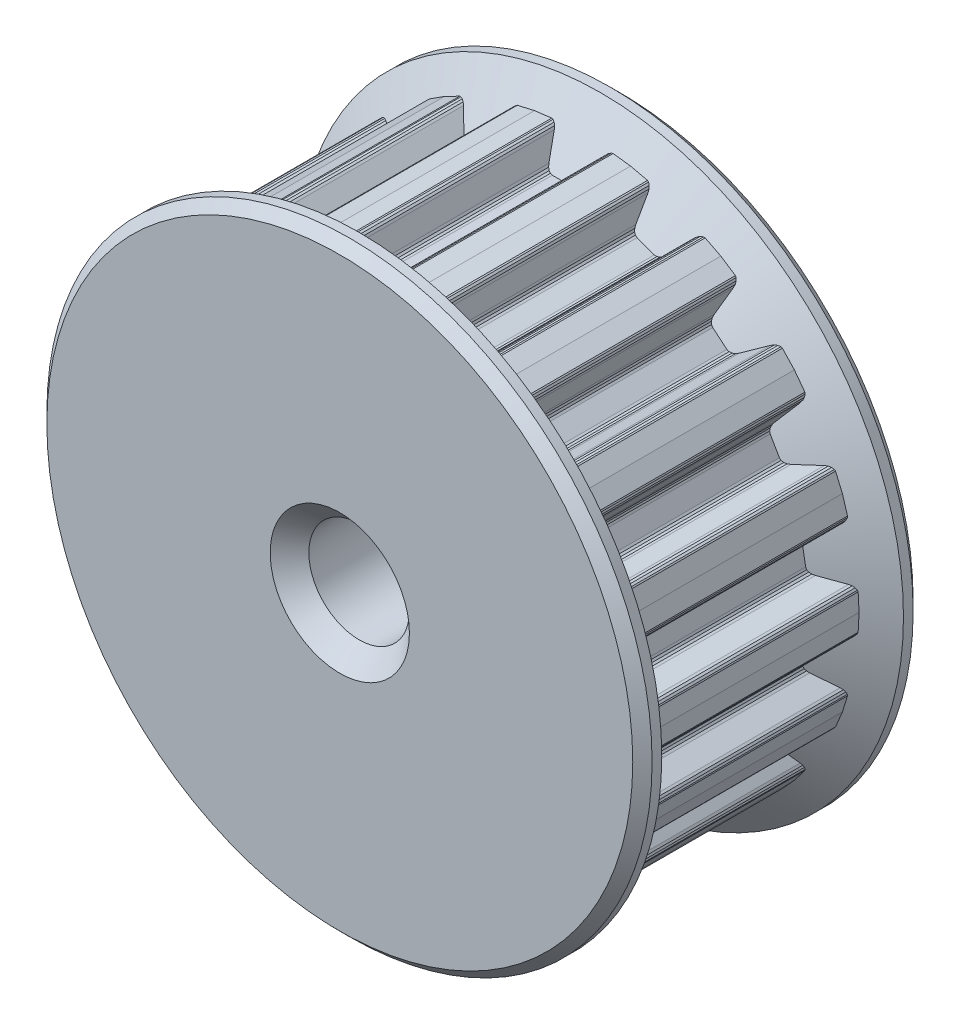
from build123d import *

# Parameters (mm, degrees)
SKETCH1_R           = 12.65
SKETCH1_R_2         = 2.6
BOSS_EXTRUDE1_DEPTH = 6.25
SKETCH2_R           = 15.65
SKETCH2_R_2         = 2.6
BOSS_EXTRUDE2_DEPTH = 1
CHAMFER1_SIZE       = 2.100622615
CHAMFER1_SIZE_2     = 3
CHAMFER2_SIZE       = 0.5
CHAMFER3_SIZE       = 1
SKETCH3_R           = 12.65
BOSS_EXTRUDE3_DEPTH = 6
SKETCH4_W           = 6.5
SKETCH4_H           = 2.5
CUT_EXTRUDE1_DEPTH  = 10.5
SKETCH5_R           = 2
CUT_EXTRUDE2_DEPTH  = 24.289643621
SKETCH6_R           = 3.25
CUT_EXTRUDE3_DEPTH  = 11.5


with BuildPart() as part:
    # Sketch1 → Boss-Extrude1 (new, symmetric)
    with BuildSketch(Plane.XY):
        Circle(SKETCH1_R)
        Circle(SKETCH1_R_2, mode=Mode.SUBTRACT)
    extrude(amount=BOSS_EXTRUDE1_DEPTH, both=True)

    # Sketch2 → Boss-Extrude2 (add)
    with BuildSketch(Plane.XY.offset(6.25)):
        Circle(SKETCH2_R)
        Circle(SKETCH2_R_2, mode=Mode.SUBTRACT)
    boss_extrude2 = extrude(amount=BOSS_EXTRUDE2_DEPTH)

    # Mirror1: Boss-Extrude2 across plane
    add(boss_extrude2.mirror(Plane.XY))

    # Chamfer1
    # the kernel refuses this chamfer: 3, 2.100622615 mm, written as the material it adds along each edge
    with BuildSketch(Plane(origin=(0, 0, -6.25), x_dir=(1, 0, 0), z_dir=(0, -1, 0))) as chamfer1_piece_1_section:
        Polygon((12.65, CHAMFER1_SIZE), (12.65 + CHAMFER1_SIZE_2, 0), (12.65, 0), align=None)
    chamfer1_piece_1 = revolve(axis=Axis((0, 0, -6.25), (0, 0, 1)), mode=Mode.PRIVATE)
    chamfer1_piece_1 = chamfer1_piece_1 & Plane(origin=(0, 0, -5.220239789), x_dir=(1, 0, 0), z_dir=(0, 0, 1)) * Cylinder(15.65, 63, mode=Mode.PRIVATE)
    add(chamfer1_piece_1)
    with BuildSketch(Plane(origin=(0, 0, 6.25), x_dir=(1, 0, 0), z_dir=(0, -1, 0))) as chamfer1_piece_2_section:
        Polygon((12.65, -CHAMFER1_SIZE), (12.65 + CHAMFER1_SIZE_2, 0), (12.65, 0), align=None)
    chamfer1_piece_2 = revolve(axis=Axis((0, 0, 6.25), (0, 0, 1)), mode=Mode.PRIVATE)
    chamfer1_piece_2 = chamfer1_piece_2 & Plane(origin=(0, 0, 5.220239789), x_dir=(1, 0, 0), z_dir=(0, 0, -1)) * Cylinder(15.65, 63, mode=Mode.PRIVATE)
    add(chamfer1_piece_2)

    # Chamfer2
    chamfer2_edges = [part.edges().sort_by_distance(p)[0] for p in [
        (-15.65, 0, 7.25),
        (-15.65, 0, -7.25),
    ]]
    chamfer(chamfer2_edges, length=CHAMFER2_SIZE)

    # Chamfer3
    chamfer3_edges = [part.edges().sort_by_distance(p)[0] for p in [
        (-2.6, 0, 7.25),
        (-2.6, 0, -7.25),
    ]]
    chamfer(chamfer3_edges, length=CHAMFER3_SIZE)

    # Sketch3 → Boss-Extrude3 (add, symmetric)
    with BuildSketch(Plane.XY):
        Polygon((-1.51068, -14.1885), (-1.40727, -14.1374), (-1.32091, -14.0571), (-1.25739, -13.9516), (-0.845001, -12.9908), (-0.781647, -12.8857), (-0.695267, -12.8054), (-0.591751, -12.7541), (-0.477005, -12.736), (0.477005, -12.736), (0.591751, -12.7541), (0.695267, -12.8054), (0.781647, -12.8857), (0.845001, -12.9908), (1.25739, -13.9516), (1.32095, -14.0571), (1.40741, -14.1374), (1.51085, -14.1885), (1.58501, -14.2001), (2.48302, -14.0819), (3.36732, -13.8858), (3.43317, -13.8495), (3.51285, -13.7661), (3.56654, -13.6611), (3.59018, -13.5403), (3.64906, -12.4964), (3.67267, -12.376), (3.72636, -12.2709), (3.80608, -12.1873), (3.90773, -12.1311), (4.80421, -11.8048), (4.91823, -11.7825), (5.03304, -11.7953), (5.14169, -11.8413), (5.23717, -11.9184), (5.95329, -12.6802), (6.0491, -12.7575), (6.15779, -12.8034), (6.27249, -12.8161), (6.34615, -12.8016), (7.14955, -12.3834), (7.91348, -11.8967), (7.96294, -11.8401), (8.00928, -11.7344), (8.02383, -11.6174), (8.00471, -11.4958), (7.70302, -10.4947), (7.68401, -10.3735), (7.69853, -10.2564), (7.74484, -10.1506), (7.82115, -10.063), (8.55197, -9.44975), (8.65149, -9.38982), (8.76375, -9.36259), (8.88158, -9.36861), (8.99765, -9.40839), (9.93115, -9.87933), (10.0476, -9.91925), (10.1655, -9.92519), (10.2776, -9.89786), (10.3418, -9.85909), (10.9538, -9.1913), (11.5052, -8.47269), (11.5323, -8.40254), (11.5397, -8.28743), (11.5133, -8.17249), (11.4538, -8.06474), (10.8279, -7.22722), (10.7685, -7.1198), (10.7422, -7.00481), (10.7495, -6.88953), (10.7912, -6.78111), (11.2682, -5.95491), (11.3412, -5.86456), (11.4374, -5.80057), (11.5502, -5.76593), (11.6729, -5.76361), (12.7112, -5.88689), (12.8343, -5.88455), (12.947, -5.84982), (13.043, -5.78581), (13.0902, -5.72739), (13.4368, -4.89058), (13.7092, -4.02672), (13.7106, -3.95154), (13.6782, -3.84082), (13.6142, -3.74184), (13.5213, -3.66096), (12.6467, -3.088), (12.5542, -3.00735), (12.4901, -2.90834), (12.4576, -2.79749), (12.4597, -2.68135), (12.6254, -1.74182), (12.6631, -1.63194), (12.7316, -1.53893), (12.8257, -1.4678), (12.9402, -1.42365), (13.958, -1.18439), (14.0729, -1.14008), (14.167, -1.06889), (14.2353, -0.975906), (14.2596, -0.904877), (14.2991, 0), (14.2596, 0.904907), (14.2353, 0.976059), (14.167, 1.06902), (14.0729, 1.14014), (13.958, 1.18439), (12.9402, 1.42365), (12.8257, 1.4678), (12.7316, 1.53893), (12.6631, 1.63194), (12.6254, 1.74182), (12.4597, 2.68135), (12.4576, 2.79749), (12.4901, 2.90834), (12.5542, 3.00735), (12.6467, 3.088), (13.5213, 3.66096), (13.6141, 3.74188), (13.6782, 3.84096), (13.7106, 3.95171), (13.7091, 4.02675), (13.4368, 4.89058), (13.0901, 5.72742), (13.043, 5.78595), (12.947, 5.84993), (12.8342, 5.88458), (12.7112, 5.88689), (11.6729, 5.76361), (11.5502, 5.76593), (11.4374, 5.80057), (11.3412, 5.86456), (11.2682, 5.95491), (10.7912, 6.78111), (10.7495, 6.88953), (10.7422, 7.00481), (10.7685, 7.1198), (10.8279, 7.22722), (11.4538, 8.06474), (11.5133, 8.17253), (11.5396, 8.28754), (11.5322, 8.40268), (11.5051, 8.47272), (10.9538, 9.1913), (10.3418, 9.8591), (10.2775, 9.89796), (10.1654, 9.92526), (10.0476, 9.91928), (9.93115, 9.87933), (8.99765, 9.40839), (8.88158, 9.36861), (8.76375, 9.36259), (8.65149, 9.38982), (8.55197, 9.44975), (7.82115, 10.063), (7.74484, 10.1506), (7.69853, 10.2564), (7.68401, 10.3735), (7.70302, 10.4947), (8.00471, 11.4958), (8.02379, 11.6174), (8.00919, 11.7345), (7.96281, 11.8402), (7.91345, 11.8967), (7.14955, 12.3834), (6.34612, 12.8016), (6.27234, 12.8161), (6.15767, 12.8035), (6.04906, 12.7576), (5.95329, 12.6802), (5.23717, 11.9184), (5.14169, 11.8413), (5.03304, 11.7953), (4.91823, 11.7825), (4.80421, 11.8048), (3.90773, 12.1311), (3.80608, 12.1873), (3.72636, 12.2709), (3.67267, 12.376), (3.64906, 12.4964), (3.59018, 13.5403), (3.5665, 13.6611), (3.51273, 13.7661), (3.43301, 13.8496), (3.36729, 13.8858), (2.48302, 14.0819), (1.58498, 14.2001), (1.51068, 14.1885), (1.40727, 14.1374), (1.32091, 14.0571), (1.25739, 13.9516), (0.845001, 12.9908), (0.781647, 12.8857), (0.695267, 12.8054), (0.591751, 12.7541), (0.477005, 12.736), (-0.477005, 12.736), (-0.591751, 12.7541), (-0.695267, 12.8054), (-0.781647, 12.8857), (-0.845001, 12.9908), (-1.25739, 13.9516), (-1.32095, 14.0571), (-1.40741, 14.1374), (-1.51085, 14.1885), (-1.58501, 14.2001), (-2.48302, 14.0819), (-3.36732, 13.8858), (-3.43317, 13.8495), (-3.51285, 13.7661), (-3.56654, 13.6611), (-3.59018, 13.5403), (-3.64906, 12.4964), (-3.67267, 12.376), (-3.72636, 12.2709), (-3.80608, 12.1873), (-3.90773, 12.1311), (-4.80421, 11.8048), (-4.91823, 11.7825), (-5.03304, 11.7953), (-5.14169, 11.8413), (-5.23717, 11.9184), (-5.95329, 12.6802), (-6.0491, 12.7575), (-6.15779, 12.8034), (-6.27249, 12.8161), (-6.34615, 12.8016), (-7.14955, 12.3834), (-7.91348, 11.8967), (-7.96294, 11.8401), (-8.00928, 11.7344), (-8.02383, 11.6174), (-8.00471, 11.4958), (-7.70302, 10.4947), (-7.68401, 10.3735), (-7.69853, 10.2564), (-7.74484, 10.1506), (-7.82115, 10.063), (-8.55197, 9.44975), (-8.65149, 9.38982), (-8.76375, 9.36259), (-8.88158, 9.36861), (-8.99765, 9.40839), (-9.93115, 9.87933), (-10.0476, 9.91925), (-10.1655, 9.92519), (-10.2776, 9.89786), (-10.3418, 9.85909), (-10.9538, 9.1913), (-11.5052, 8.47269), (-11.5323, 8.40254), (-11.5397, 8.28743), (-11.5133, 8.17249), (-11.4538, 8.06474), (-10.8279, 7.22722), (-10.7685, 7.1198), (-10.7422, 7.00481), (-10.7495, 6.88953), (-10.7912, 6.78111), (-11.2682, 5.95491), (-11.3412, 5.86456), (-11.4374, 5.80057), (-11.5502, 5.76593), (-11.6729, 5.76361), (-12.7112, 5.88689), (-12.8343, 5.88455), (-12.947, 5.84982), (-13.043, 5.78581), (-13.0902, 5.72739), (-13.4368, 4.89058), (-13.7092, 4.02672), (-13.7106, 3.95154), (-13.6782, 3.84082), (-13.6142, 3.74184), (-13.5213, 3.66096), (-12.6467, 3.088), (-12.5542, 3.00735), (-12.4901, 2.90834), (-12.4576, 2.79749), (-12.4597, 2.68135), (-12.6254, 1.74182), (-12.6631, 1.63194), (-12.7316, 1.53893), (-12.8257, 1.4678), (-12.9402, 1.42365), (-13.958, 1.18439), (-14.0729, 1.14008), (-14.167, 1.06889), (-14.2353, 0.975906), (-14.2596, 0.904877), (-14.2991, 0), (-14.2596, -0.904907), (-14.2353, -0.976059), (-14.167, -1.06902), (-14.0729, -1.14014), (-13.958, -1.18439), (-12.9402, -1.42365), (-12.8257, -1.4678), (-12.7316, -1.53893), (-12.6631, -1.63194), (-12.6254, -1.74182), (-12.4597, -2.68135), (-12.4576, -2.79749), (-12.4901, -2.90834), (-12.5542, -3.00735), (-12.6467, -3.088), (-13.5213, -3.66096), (-13.6141, -3.74188), (-13.6782, -3.84096), (-13.7106, -3.95171), (-13.7091, -4.02675), (-13.4368, -4.89058), (-13.0901, -5.72742), (-13.043, -5.78595), (-12.947, -5.84993), (-12.8342, -5.88458), (-12.7112, -5.88689), (-11.6729, -5.76361), (-11.5502, -5.76593), (-11.4374, -5.80057), (-11.3412, -5.86456), (-11.2682, -5.95491), (-10.7912, -6.78111), (-10.7495, -6.88953), (-10.7422, -7.00481), (-10.7685, -7.1198), (-10.8279, -7.22722), (-11.4538, -8.06474), (-11.5133, -8.17253), (-11.5396, -8.28754), (-11.5322, -8.40268), (-11.5051, -8.47272), (-10.9538, -9.1913), (-10.3418, -9.8591), (-10.2775, -9.89796), (-10.1654, -9.92526), (-10.0476, -9.91928), (-9.93115, -9.87933), (-8.99765, -9.40839), (-8.88158, -9.36861), (-8.76375, -9.36259), (-8.65149, -9.38982), (-8.55197, -9.44975), (-7.82115, -10.063), (-7.74484, -10.1506), (-7.69853, -10.2564), (-7.68401, -10.3735), (-7.70302, -10.4947), (-8.00471, -11.4958), (-8.02379, -11.6174), (-8.00919, -11.7345), (-7.96281, -11.8402), (-7.91345, -11.8967), (-7.14955, -12.3834), (-6.34612, -12.8016), (-6.27234, -12.8161), (-6.15767, -12.8035), (-6.04906, -12.7576), (-5.95329, -12.6802), (-5.23717, -11.9184), (-5.14169, -11.8413), (-5.03304, -11.7953), (-4.91823, -11.7825), (-4.80421, -11.8048), (-3.90773, -12.1311), (-3.80608, -12.1873), (-3.72636, -12.2709), (-3.67267, -12.376), (-3.64906, -12.4964), (-3.59018, -13.5403), (-3.5665, -13.6611), (-3.51273, -13.7661), (-3.43301, -13.8496), (-3.36729, -13.8858), (-2.48302, -14.0819), (-1.58498, -14.2001), align=None)
        Circle(SKETCH3_R, mode=Mode.SUBTRACT)
    extrude(amount=BOSS_EXTRUDE3_DEPTH, both=True)

    # Sketch4 → Cut-Extrude1 (cut)
    with BuildSketch(Plane(origin=(0, 0, -7.25), x_dir=(-1, 0, 0), z_dir=(0, 0, -1))):
        with Locations((0, -5.25)):
            Rectangle(SKETCH4_W, SKETCH4_H)
    extrude(amount=-CUT_EXTRUDE1_DEPTH, mode=Mode.SUBTRACT)

    # Sketch5 → Cut-Extrude2 (cut, through all)
    with BuildSketch(Plane(origin=(0, 0, 0), x_dir=(1, 0, 0), z_dir=(0, 1, 0))):
        with Locations(Location((0, 0, 0), (0, 0, 270))):
            Circle(SKETCH5_R)
    extrude(amount=-CUT_EXTRUDE2_DEPTH, mode=Mode.SUBTRACT)

    # Sketch6 → Cut-Extrude3 (cut)
    with BuildSketch(Plane(origin=(0, -20, 0), x_dir=(1, 0, 0), z_dir=(0, 1, 0))):
        with Locations(Location((0, 0, 0), (0, 0, 90))):
            Circle(SKETCH6_R)
    extrude(amount=CUT_EXTRUDE3_DEPTH, mode=Mode.SUBTRACT)


solid = part.part
